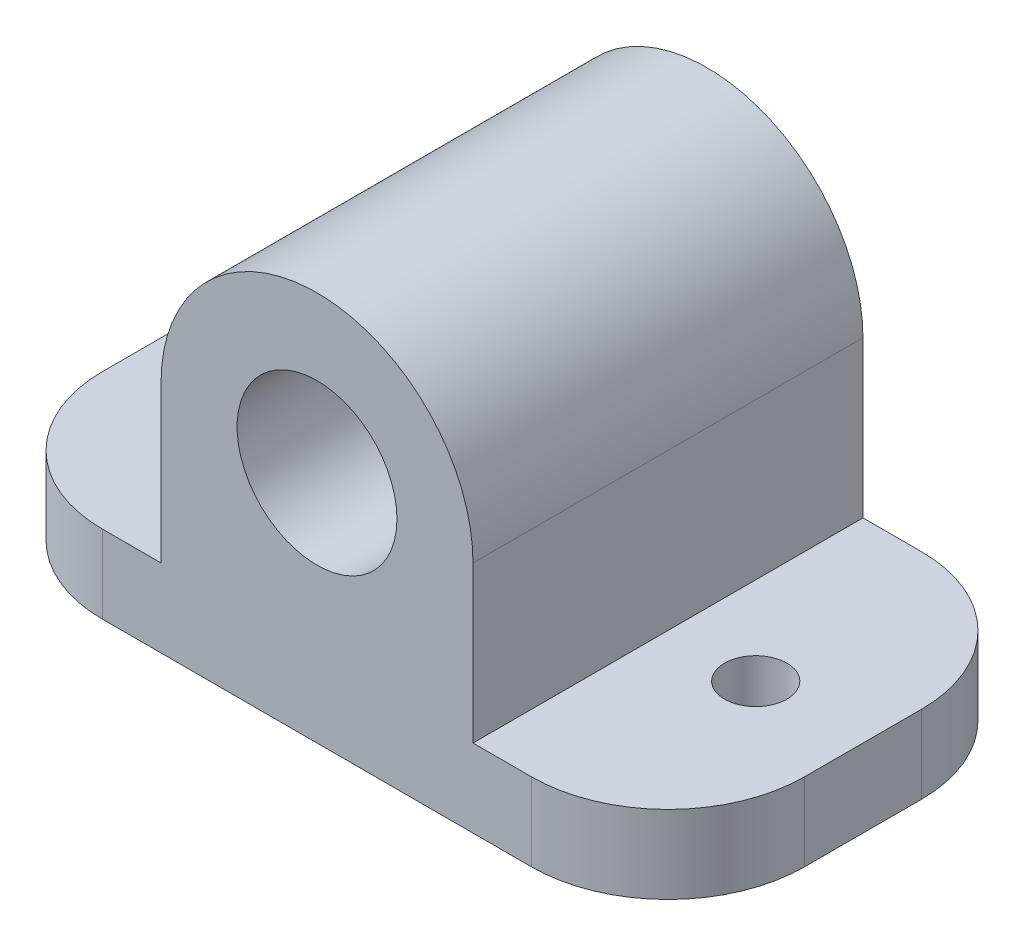
from build123d import *

# Parameters (mm, degrees)
ESBO_O1_R                = 4.1
RESSALTO_EXTRUS_O1_DEPTH = 20
ESBO_O2_R                = 1.6
CORTE_EXTRUS_O1_DEPTH    = 20
FILETE1_R                = 7


with BuildPart() as part:
    # Esboço1 → Ressalto-extrusão1 (new body)
    with BuildSketch(Plane.XY):
        with BuildLine():
            Line((-8, 0), (-8, -8))
            Line((-8, -8), (-18, -8))
            Line((-18, -8), (-18, -12))
            Line((-18, -12), (18, -12))
            Line((18, -12), (18, -8))
            Line((18, -8), (8, -8))
            Line((8, -8), (8, 0))
            ThreePointArc((8, 0), (0, 8), (-8, 0))
        make_face()
        Circle(ESBO_O1_R, mode=Mode.SUBTRACT)
    extrude(amount=RESSALTO_EXTRUS_O1_DEPTH)

    # Esboço2 → Corte-extrusão1 (cut)
    with BuildSketch(Plane(origin=(0, -8, 0), x_dir=(1, 0, 0), z_dir=(0, 1, 0))):
        with Locations((-12.5, -10)):
            Circle(ESBO_O2_R)
        with Locations((12.5, -10)):
            Circle(ESBO_O2_R)
    extrude(amount=-CORTE_EXTRUS_O1_DEPTH, mode=Mode.SUBTRACT)

    # Filete1
    filete1_edges = [part.edges().sort_by_distance(p)[0] for p in [
        (-18, -10, 0),
        (-18, -10, 20),
        (18, -10, 20),
        (18, -10, 0),
    ]]
    fillet(filete1_edges, radius=FILETE1_R)


solid = part.part
